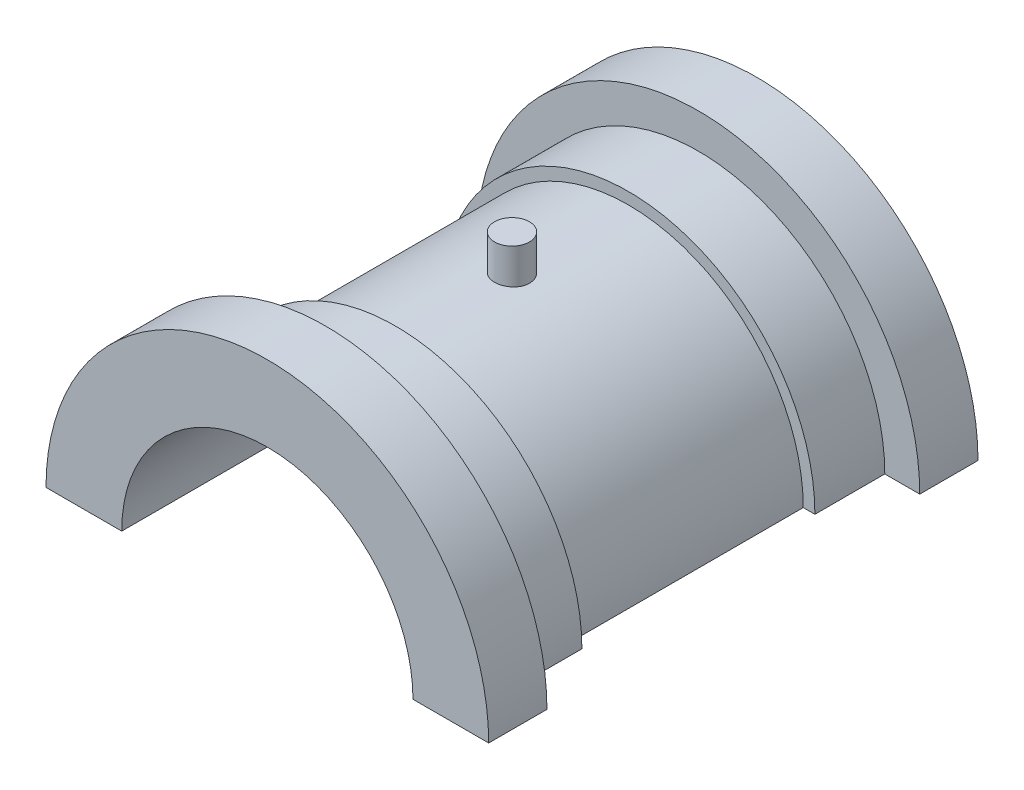
from build123d import *

# Parameters (mm, degrees)
REVOLVE1_START                       = -42
REVOLVE1_DEPTH                       = 42
REVOLVE1_2_DEPTH                     = 10
REVOLVE1_START_2                     = -32
REVOLVE1_3_DEPTH                     = 12
SKETCH2_R                            = 3
BOSS_EXTRUDE1_DEPTH                  = 6
BOSS_EXTRUDE1_DIRECTION_2_REACH      = 66.094
BOSS_EXTRUDE1_DIRECTION_2_END_RADIUS = 30


# Read off the part's stored shape, not the designer's step: Revolve1
with BuildPart() as part:
    # Revolve1 outline → Revolve1 (new body)
    with BuildSketch(Plane.XY.offset(REVOLVE1_START)):
        with BuildLine():
            ThreePointArc((-25, 0), (0, 25), (25, 0))
            Line((25, 0), (30, 0))
            ThreePointArc((30, 0), (0, 30), (-30, 0))
            Line((-30, 0), (-25, 0))
        make_face()
    revolve1 = extrude(amount=REVOLVE1_DEPTH)



with BuildPart() as body_2:
    # Revolve1 2 outline → Revolve1 2 (new body)
    with BuildSketch(Plane.XY.offset(REVOLVE1_START)):
        with BuildLine():
            ThreePointArc((-30, 0), (0, 30), (30, 0))
            Line((30, 0), (38, 0))
            ThreePointArc((38, 0), (0, 38), (-38, 0))
            Line((-38, 0), (-30, 0))
        make_face()
    revolve1_2 = extrude(amount=REVOLVE1_2_DEPTH)


with BuildPart() as part_1:
    add(part.part)

    add(body_2.part)  # Revolve1 3 merges body 2
    # Revolve1 3 outline → Revolve1 3 (add)
    with BuildSketch(Plane.XY.offset(REVOLVE1_START_2)):
        with BuildLine():
            ThreePointArc((-30, 0), (0, 30), (30, 0))
            Line((30, 0), (32, 0))
            ThreePointArc((32, 0), (0, 32), (-32, 0))
            Line((-32, 0), (-30, 0))
        make_face()
    revolve1_3 = extrude(amount=REVOLVE1_3_DEPTH)

    # Mirror1: Revolve1, Revolve1 2, Revolve1 3 across plane
    add(revolve1.mirror(Plane(origin=(30, 0, 0), x_dir=(1, 0, 0), z_dir=(0, 0, -1))))
    add(revolve1_2.mirror(Plane(origin=(30, 0, 0), x_dir=(1, 0, 0), z_dir=(0, 0, -1))))
    add(revolve1_3.mirror(Plane(origin=(30, 0, 0), x_dir=(1, 0, 0), z_dir=(0, 0, -1))))

    # Sketch2 → Boss-Extrude1 (add)
    with BuildSketch(Plane(origin=(0, 30, 0), x_dir=(1, 0, 0), z_dir=(0, 1, 0))):
        with Locations(Location((0, 0, 0), (0, 0, 90))):
            Circle(SKETCH2_R)
    extrude(amount=BOSS_EXTRUDE1_DEPTH)

    # Boss-Extrude1 direction 2: up to this cylinder (the profile starts outside it)
    boss_extrude1_direction_2_end = Plane(origin=(0, 0, 0), z_dir=(0, 0, 1)) * Cylinder(BOSS_EXTRUDE1_DIRECTION_2_END_RADIUS, 193.188, mode=Mode.PRIVATE)
    # Sketch2 → Boss-Extrude1 direction 2 (add, up to the surface)
    with BuildSketch(Plane(origin=(0, 30, 0), x_dir=(1, 0, 0), z_dir=(0, 1, 0)), mode=Mode.PRIVATE) as boss_extrude1_direction_2_sk1:
        with Locations(Location((0, 0, 0), (0, 0, 90))):
            Circle(SKETCH2_R)
    boss_extrude1_direction_2_tool1 = extrude(boss_extrude1_direction_2_sk1.sketch, amount=-BOSS_EXTRUDE1_DIRECTION_2_REACH, mode=Mode.PRIVATE) - boss_extrude1_direction_2_end
    add(boss_extrude1_direction_2_tool1.solids().sort_by_distance((0, 30, 0))[0])
    add(boss_extrude1_direction_2_tool1.solids().sort_by_distance((0, 30, 0))[1])


solid = part_1.part
